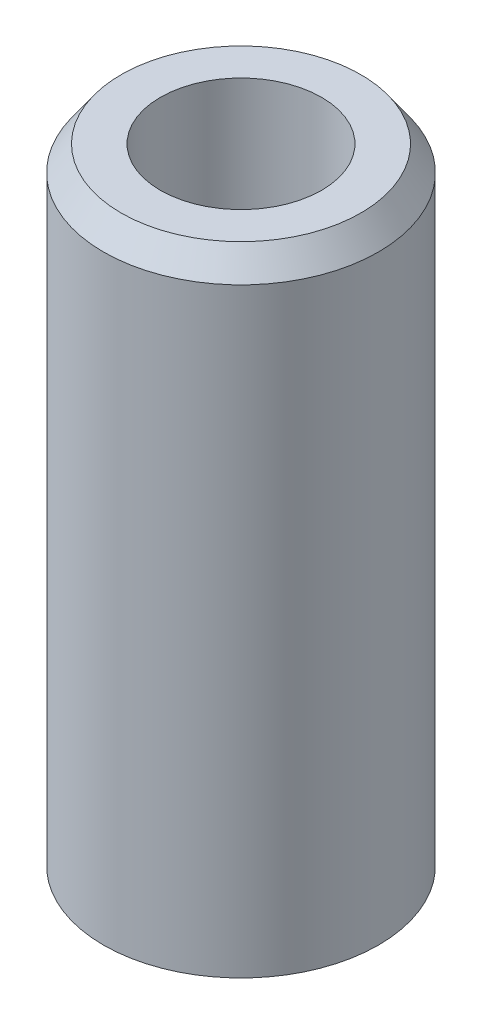
from build123d import *
from OCP.BRepFilletAPI import BRepFilletAPI_MakeChamfer

# Parameters (mm, degrees)
SKETCH1_R           = 27.5
BOSS_EXTRUDE1_DEPTH = 128.582482353
SKETCH2_R           = 16.124163976
CUT_EXTRUDE1_DEPTH  = 135.335232788
CHAMFER1_SIZE       = 4.992240171
CHAMFER1_SIZE2      = 3.521079448


with BuildPart() as part:
    # Sketch1 → Boss-Extrude1 (new body)
    with BuildSketch(Plane(origin=(0, 0, 0), x_dir=(1, 0, 0), z_dir=(0, 1, 0))):
        Circle(SKETCH1_R)
    extrude(amount=BOSS_EXTRUDE1_DEPTH)

    # Sketch2 → Cut-Extrude1 (cut, through all)
    with BuildSketch(Plane(origin=(0, 0, 0), x_dir=(1, 0, 0), z_dir=(0, 1, 0))):
        Circle(SKETCH2_R)
    extrude(amount=CUT_EXTRUDE1_DEPTH, mode=Mode.SUBTRACT)

    # Chamfer1: one chamfer whose edges measure the first distance from different faces: ONE call of the kernel's chamfer builder (chamfer() names one face for all edges)
    chamfer1_edges_1 = [part.edges().sort_by_distance(p)[0] for p in [
        (-27.5, 128.582482353, 0),
    ]]
    chamfer1_side_1 = [part.faces().sort_by_distance(p)[0] for p in [
        (-27.5, 64.291241177, 0),
    ]]
    chamfer1_edges_2 = [part.edges().sort_by_distance(p)[0] for p in [
        (-27.5, 0, 0),
    ]]
    chamfer1_side_2 = [part.faces().sort_by_distance(p)[0] for p in [
        (-26.722182541, 0, 0),
    ]]
    chamfer1 = BRepFilletAPI_MakeChamfer(part.part.solid().wrapped)
    for e in chamfer1_edges_1:
        chamfer1.Add(CHAMFER1_SIZE, CHAMFER1_SIZE2, e.wrapped, chamfer1_side_1[0].wrapped)  # the first distance lies on this face
    for e in chamfer1_edges_2:
        chamfer1.Add(CHAMFER1_SIZE, CHAMFER1_SIZE2, e.wrapped, chamfer1_side_2[0].wrapped)  # the first distance lies on this face
    add(Compound.cast(chamfer1.Shape()), mode=Mode.REPLACE)


solid = part.part
